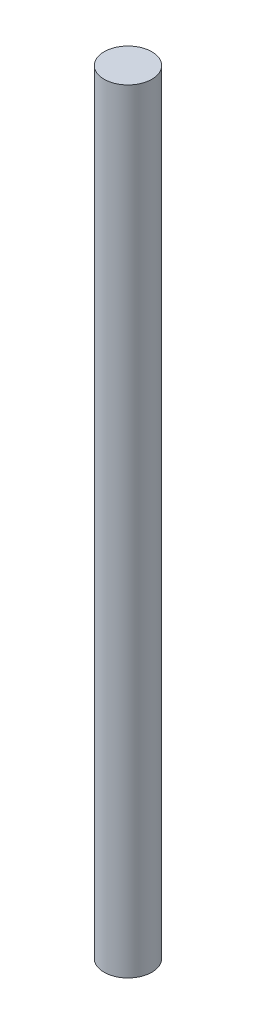
from build123d import *

# Parameters (mm, degrees)
SKETCH1_R           = 1.45
BOSS_EXTRUDE1_DEPTH = 47


with BuildPart() as part:
    # Sketch1 → Boss-Extrude1 (new body)
    with BuildSketch(Plane(origin=(0, 0, 0), x_dir=(1, 0, 0), z_dir=(0, 1, 0))):
        Circle(SKETCH1_R)
    extrude(amount=BOSS_EXTRUDE1_DEPTH)


solid = part.part
